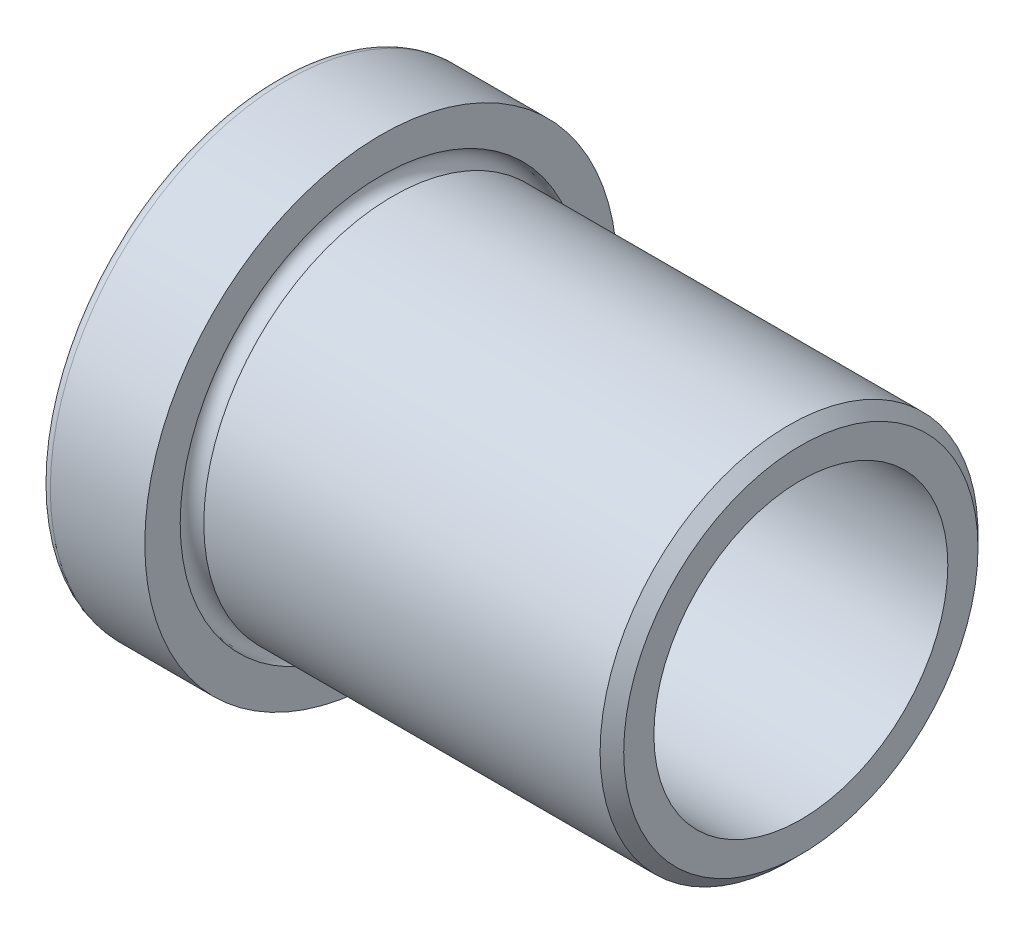
from build123d import *


with BuildPart() as part:
    # Sketch1 → BaseBody (revolve)
    with BuildSketch(Plane.XY):
        with BuildLine():
            Line((0, 25.4), (0, 34.1249))
            ThreePointArc((0, 34.1249), (0.464967985, 35.247432015), (1.5875, 35.7124))
            Line((1.5875, 35.7124), (15.875, 35.7124))
            Line((15.875, 35.7124), (15.875, 30.35935))
            ThreePointArc((15.875, 30.35935), (14.613274015, 27.313274015), (17.65935, 28.575))
            Line((17.65935, 28.575), (77.5890625, 28.575))
            Line((77.5890625, 28.575), (79.375, 26.7890625))
            Line((79.375, 26.7890625), (79.375, 22.225))
            Line((79.375, 22.225), (3.175, 22.225))
            ThreePointArc((3.175, 22.225), (0.92993597, 23.15493597), (0, 25.4))
        make_face()
    revolve(axis=Axis((0, 0, 0), (1, 0, 0)))


solid = part.part
